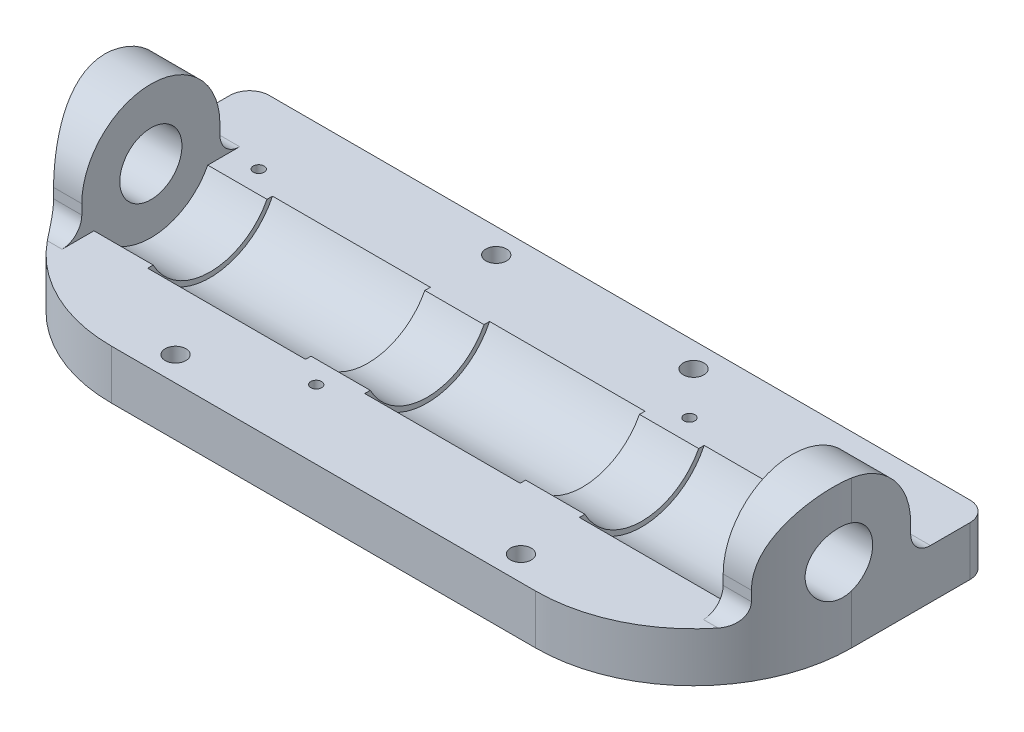
from build123d import *

# Parameters (mm, degrees)
BOSS_EXTRUDE1_DEPTH      = 75
BOSS_EXTRUDE1_DEPTH_BACK = 75
BOSS_EXTRUDE2_START      = -10
SKETCH2_R                = 6.3
BOSS_EXTRUDE2_DEPTH      = 10
SKETCH3_R                = 6.3
BOSS_EXTRUDE3_DEPTH      = 10
SKETCH4_R                = 1.1
CUT_EXTRUDE1_DEPTH       = 84.216584885
SKETCH5_R                = 2.1
CUT_EXTRUDE2_DEPTH       = 87.168439698
CUT_EXTRUDE3_DEPTH       = 6
FILLET1_R                = 4
FILLET2_R                = 4
FILLET3_R                = 32
BOSS_EXTRUDE4_DEPTH      = 12
BOSS_EXTRUDE5_START      = -43.5
BOSS_EXTRUDE5_DEPTH      = 12
BOSS_EXTRUDE7_START      = 44
BOSS_EXTRUDE7_DEPTH      = 12
SKETCH16_R               = 13
CUT_EXTRUDE8_DEPTH       = 99.5


with BuildPart() as part:
    # Sketch1 → Boss-Extrude1 (new, two sides: drawn at the far end of the back side and taken through both)
    with BuildSketch(Plane(origin=(0, 0, 0), x_dir=(0, 0, -1), z_dir=(1, 0, 0)).offset(-BOSS_EXTRUDE1_DEPTH_BACK)):
        with BuildLine():
            Line((-12.649110641, -6), (-30, -6))
            Line((-30, -6), (-30, -16))
            Line((-30, -16), (30, -16))
            Line((30, -16), (30, -6))
            Line((30, -6), (12.649110641, -6))
            ThreePointArc((12.649110641, -6), (0, -14), (-12.649110641, -6))
        make_face()
    extrude(amount=BOSS_EXTRUDE1_DEPTH + BOSS_EXTRUDE1_DEPTH_BACK)

    # Sketch2 → Boss-Extrude2 (add)
    with BuildSketch(Plane(origin=(75, 0, 0), x_dir=(0, 0, -1), z_dir=(1, 0, 0)).offset(BOSS_EXTRUDE2_START)):
        with BuildLine():
            Line((-14, 0), (-14, -16))
            Line((-14, -16), (14, -16))
            Line((14, -16), (14, 0))
            ThreePointArc((14, 0), (0, 14), (-14, 0))
        make_face()
        Circle(SKETCH2_R, mode=Mode.SUBTRACT)
    extrude(amount=BOSS_EXTRUDE2_DEPTH)

    # Sketch3 → Boss-Extrude3 (add)
    with BuildSketch(Plane.ZY.offset(75)):
        with BuildLine():
            Line((-14, 0), (-14, -16))
            Line((-14, -16), (14, -16))
            Line((14, -16), (14, 0))
            ThreePointArc((14, 0), (0, 14), (-14, 0))
        make_face()
        with Locations(Location((0, 0, 0), (0, 0, 180))):
            Circle(SKETCH3_R, mode=Mode.SUBTRACT)
    extrude(amount=-BOSS_EXTRUDE3_DEPTH)

    # Sketch4 → Cut-Extrude1 (cut, through all)
    with BuildSketch(Plane(origin=(0, -6, 0), x_dir=(1, 0, 0), z_dir=(0, 1, 0))):
        with Locations(Location((-15.4853, -16, 0), (0, 0, 270))):
            Circle(SKETCH4_R)
        with Locations(Location((-59.1364, 16, 0), (0, 0, 270))):
            Circle(SKETCH4_R)
        with Locations(Location((28.1658, 16, 0), (0, 0, 270))):
            Circle(SKETCH4_R)
    extrude(amount=-CUT_EXTRUDE1_DEPTH, mode=Mode.SUBTRACT)

    # Sketch5 → Cut-Extrude2 (cut, through all)
    with BuildSketch(Plane.XZ.offset(16)):
        with Locations(Location((-35, 25, 0), (0, 0, 270))):
            Circle(SKETCH5_R)
        with Locations(Location((35, 25, 0), (0, 0, 270))):
            Circle(SKETCH5_R)
        with Locations(Location((-20, -25, 0), (0, 0, 270))):
            Circle(SKETCH5_R)
        with Locations(Location((20, -25, 0), (0, 0, 270))):
            Circle(SKETCH5_R)
    extrude(amount=-CUT_EXTRUDE2_DEPTH, mode=Mode.SUBTRACT)

    # Sketch7 → Cut-Extrude3 (cut)
    with BuildSketch(Plane.XZ.offset(16)):
        Polygon((-37.078460969, 28.6), (-39.156921938, 25), (-37.078460969, 21.4), (-32.921539031, 21.4), (-30.843078062, 25), (-32.921539031, 28.6), align=None)
        Polygon((32.921539031, 28.6), (30.843078062, 25), (32.921539031, 21.4), (37.078460969, 21.4), (39.156921938, 25), (37.078460969, 28.6), align=None)
        Polygon((-22.078460969, -21.4), (-24.156921938, -25), (-22.078460969, -28.6), (-17.921539031, -28.6), (-15.843078062, -25), (-17.921539031, -21.4), align=None)
        Polygon((17.921539031, -21.4), (15.843078062, -25), (17.921539031, -28.6), (22.078460969, -28.6), (24.156921938, -25), (22.078460969, -21.4), align=None)
    extrude(amount=-CUT_EXTRUDE3_DEPTH, mode=Mode.SUBTRACT)

    # Fillet1
    fillet1_edges = [part.edges().sort_by_distance(p)[0] for p in [
        (70, -6, -14),
        (70, -6, 14),
        (-70, -6, 14),
        (-70, -6, -14),
    ]]
    fillet(fillet1_edges, radius=FILLET1_R)

    # Fillet2
    fillet2_edges = [part.edges().sort_by_distance(p)[0] for p in [
        (-75, -11, -30),
        (75, -11, -30),
    ]]
    fillet(fillet2_edges, radius=FILLET2_R)

    # Fillet3
    # the kernel refuses this fillet: 32 mm, written as the material it takes off along each edge
    with BuildSketch(Plane(origin=(75, 74, 30), x_dir=(0, 0, -1), z_dir=(0, -1, 0)), Plane(origin=(-75, 74, 30), x_dir=(1, 0, 0), z_dir=(0, -1, 0))) as fillet3_piece_1:
        with BuildLine():
            CenterArc((FILLET3_R, -FILLET3_R), FILLET3_R, 90, 90)
            Line((0, -FILLET3_R), (0, 0))
            Line((0, 0), (FILLET3_R, 0))
        make_face()
    extrude(amount=170, mode=Mode.SUBTRACT)

    # Sketch8 → Boss-Extrude4 (add)
    with BuildSketch(Plane.ZY.offset(21)):
        with BuildLine():
            Line((-10.9658561, -6), (-13.747727085, -6))
            ThreePointArc((-13.747727085, -6), (0, -15), (13.747727085, -6))
            Line((13.747727085, -6), (10.9658561, -6))
            ThreePointArc((10.9658561, -6), (0, -12.5), (-10.9658561, -6))
        make_face()
    extrude(amount=-BOSS_EXTRUDE4_DEPTH)

    # Sketch8<2> → Boss-Extrude5 (add)
    with BuildSketch(Plane.ZY.offset(21).offset(BOSS_EXTRUDE5_START)):
        with BuildLine():
            Line((-10.9658561, -6), (-13.747727085, -6))
            ThreePointArc((-13.747727085, -6), (0, -15), (13.747727085, -6))
            Line((13.747727085, -6), (10.9658561, -6))
            ThreePointArc((10.9658561, -6), (0, -12.5), (-10.9658561, -6))
        make_face()
    extrude(amount=-BOSS_EXTRUDE5_DEPTH)

    # Sketch8<4> → Boss-Extrude7 (add)
    with BuildSketch(Plane.ZY.offset(21).offset(BOSS_EXTRUDE7_START)):
        with BuildLine():
            Line((-10.9658561, -6), (-13.747727085, -6))
            ThreePointArc((-13.747727085, -6), (0, -15), (13.747727085, -6))
            Line((13.747727085, -6), (10.9658561, -6))
            ThreePointArc((10.9658561, -6), (0, -12.5), (-10.9658561, -6))
        make_face()
    extrude(amount=-BOSS_EXTRUDE7_DEPTH)

    # Sketch16 → Cut-Extrude8 (cut)
    with BuildSketch(Plane(origin=(-65, 0, 0), x_dir=(0, 0, -1), z_dir=(1, 0, 0))):
        Circle(SKETCH16_R)
    extrude(amount=CUT_EXTRUDE8_DEPTH, mode=Mode.SUBTRACT)


solid = part.part
